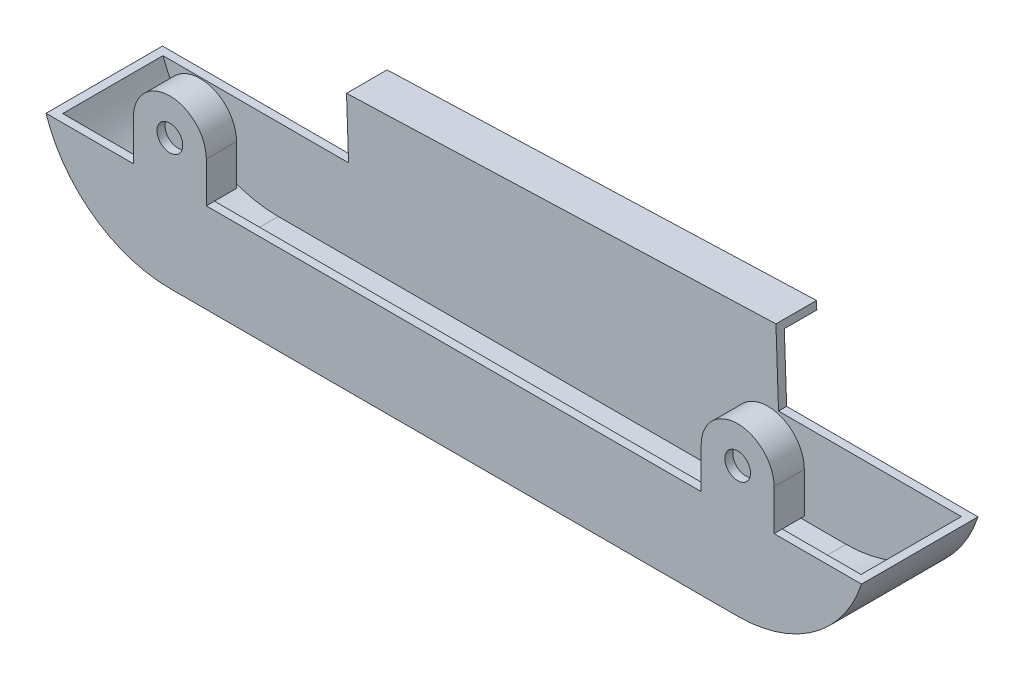
from build123d import *

# Parameters (mm, degrees)
BOSS_EXTRUDE7_DEPTH = 71.818
SHELL8_START        = 5
SHELL8_DEPTH        = 61.818
BOSS_EXTRUDE4_DEPTH = 18.636
SHELL7_START        = 58.182
SHELL7_DEPTH        = 8.636
SKETCH5_R           = 7.9375
CUT_EXTRUDE1_DEPTH  = 274.461475598
BOSS_EXTRUDE5_DEPTH = 5
BOSS_EXTRUDE6_DEPTH = 20


# Read off the part's stored shape, not the designer's step: Shell8, Shell7
with BuildPart() as part:
    # Sketch3 → Boss-Extrude7 (new body)
    with BuildSketch(Plane.XY):
        with BuildLine():
            ThreePointArc((-251.338111427, -25), (-222.139790815, -65.041120671), (-175, -80.3275))
            Line((-175, -80.3275), (175, -80.3275))
            ThreePointArc((175, -80.3275), (222.139790815, -65.041120671), (251.338111427, -25))
            Line((251.338111427, -25), (-251.338111427, -25))
        make_face()
    extrude(amount=BOSS_EXTRUDE7_DEPTH)

    # Shell8 outline → Shell8 (cut)
    with BuildSketch(Plane.XY.offset(SHELL8_START)):
        with BuildLine():
            ThreePointArc((-246.057949986, -25), (-218.537597294, -61.471211783), (-175, -75.3275))
            Line((-175, -75.3275), (175, -75.3275))
            ThreePointArc((175, -75.3275), (218.537597294, -61.471211783), (246.057949986, -25))
            Line((246.057949986, -25), (-246.057949986, -25))
        make_face()
    extrude(amount=SHELL8_DEPTH, mode=Mode.SUBTRACT)

    # Sketch4 → Boss-Extrude4 (add)
    with BuildSketch(Plane.XY.offset(71.818)):
        with BuildLine():
            Line((152.535, -25), (197.465, -25))
            Line((197.465, -25), (197.465, 0))
            ThreePointArc((197.465, 0), (175, 22.465), (152.535, 0))
            Line((152.535, 0), (152.535, -25))
        make_face()
        with BuildLine():
            Line((-197.465, 0), (-197.465, -25))
            Line((-197.465, -25), (-152.535, -25))
            Line((-152.535, -25), (-152.535, 0))
            ThreePointArc((-152.535, 0), (-175, 22.465), (-197.465, 0))
        make_face()
    extrude(amount=-BOSS_EXTRUDE4_DEPTH)

    # Shell7 outline → Shell7 (cut)
    with BuildSketch(Plane.XY.offset(SHELL7_START)):
        with BuildLine():
            Line((192.465, -25), (192.465, 0))
            ThreePointArc((192.465, 0), (175, 17.465), (157.535, 0))
            Line((157.535, 0), (157.535, -25))
            Line((157.535, -25), (192.465, -25))
        make_face()
        with BuildLine():
            ThreePointArc((-157.535, 0), (-175, 17.465), (-192.465, 0))
            Line((-192.465, 0), (-192.465, -25))
            Line((-192.465, -25), (-157.535, -25))
            Line((-157.535, -25), (-157.535, 0))
        make_face()
    extrude(amount=SHELL7_DEPTH, mode=Mode.SUBTRACT)

    # Sketch5 → Cut-Extrude1 (cut, through all)
    with BuildSketch(Plane.XY.offset(71.818)):
        with Locations((175, 0)):
            Circle(SKETCH5_R)
        with Locations((-175, 0)):
            Circle(SKETCH5_R)
    extrude(amount=-CUT_EXTRUDE1_DEPTH, mode=Mode.SUBTRACT)

    # Sketch13 → Boss-Extrude5 (add)
    with BuildSketch(Plane(origin=(0, 0, 0), x_dir=(-1, 0, 0), z_dir=(0, 0, -1))):
        Polygon((131.634946049, -25), (132.910361442, 11.477741548), (-131.784153156, 20.732575975), (-133.383156517, -25), align=None)
    extrude(amount=-BOSS_EXTRUDE5_DEPTH)

    # Sketch14 → Boss-Extrude6 (add)
    with BuildSketch(Plane(origin=(0, 0, 0), x_dir=(-1, 0, 0), z_dir=(0, 0, -1))):
        Polygon((-131.784153156, 20.732575975), (-131.958867442, 15.735629415), (132.735647156, 6.480794988), (132.910361442, 11.477741548), align=None)
    extrude(amount=BOSS_EXTRUDE6_DEPTH)


solid = part.part
